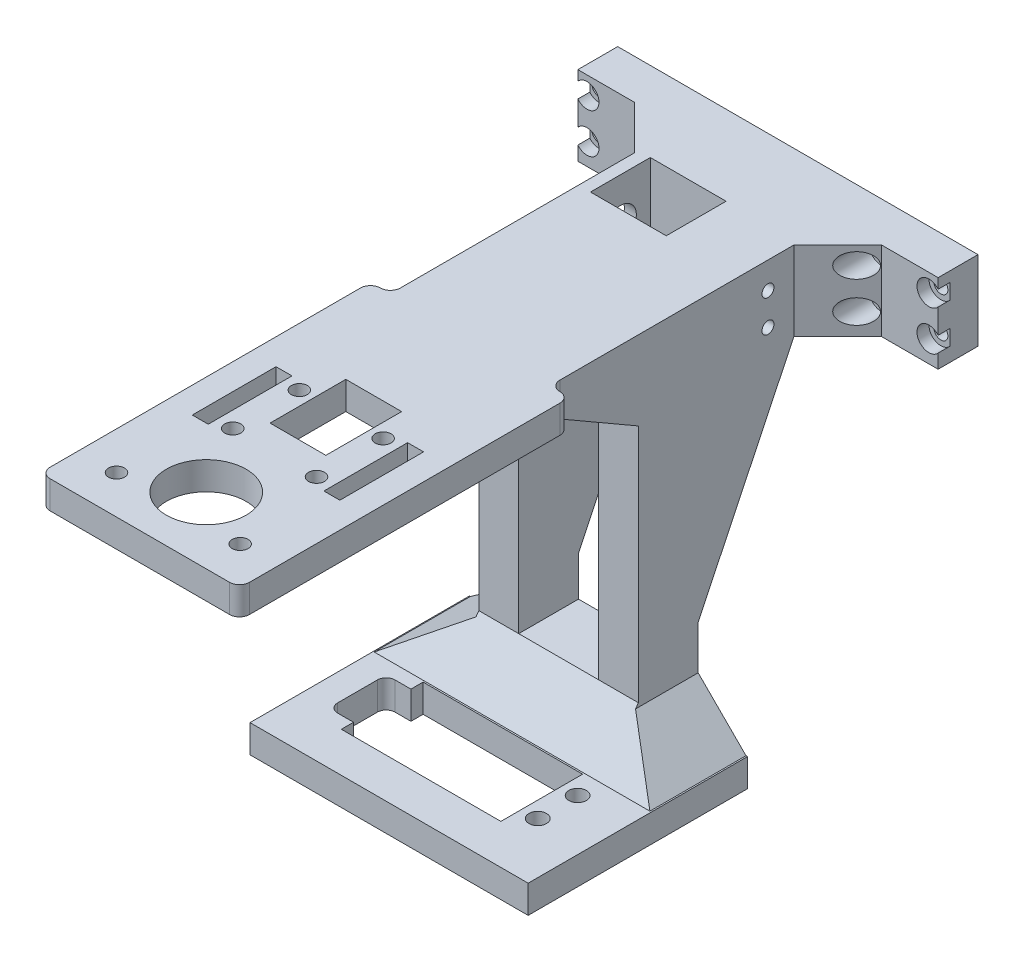
from build123d import *

# Parameters (mm, degrees)
SKETCH_1_W           = 90.34
SKETCH_1_H           = 19.9
SKETCH_1_R           = 1.75
EXTRUDE_1_DEPTH      = 10
SKETCH_2_W           = 40
SKETCH_2_H           = 19.9
EXTRUDE_2_DEPTH      = 50
SKETCH_3_W           = 40
SKETCH_3_H           = 15
EXTRUDE_3_DEPTH      = 73
SKETCH_4_R           = 2.2
EXTRUDE_4_DEPTH      = 7
SKETCH_15_R          = 3
CUT_EXTRUDE_5_DEPTH  = 3
CUT_EXTRUDE_START    = -10
SKETCH_16_W          = 15
SKETCH_16_H          = 60
CUT_EXTRUDE_6_DEPTH  = 20
CHAMFER_3_SIZE       = 9.102697997
CHAMFER_3_SIZE_2     = 13
CHAMFER_1_SIZE       = 11
SKETCH_22_W          = 40
SKETCH_22_H          = 7
EXTRUDE_7_DEPTH      = 105
SKETCH_23_R          = 2
SKETCH_23_R_2        = 10
SKETCH_23_W          = 4
SKETCH_23_H          = 21
SKETCH_23_W_2        = 14
SKETCH_23_H_2        = 19
CUT_EXTRUDE_9_DEPTH  = 7
CHAMFER_4_SIZE       = 12.8
CHAMFER_4_SIZE2      = 22.170250337
SKETCH_25_W          = 82.829749663
SKETCH_25_H          = 7
EXTRUDE_8_DEPTH      = 5
SKETCH_26_W          = 82.829749663
SKETCH_26_H          = 7
EXTRUDE_9_DEPTH      = 5
SKETCH_28_W          = 64.74
SKETCH_28_H          = 5
EXTRUDE_10_DEPTH     = 7
SKETCH_31_W          = 25
SKETCH_31_H          = 19.9
SKETCH_31_W_2        = 10
EXTRUDE_12_DEPTH     = 20
SKETCH_33_R          = 4
CUT_EXTRUDE_11_DEPTH = 10
SKETCH_32_R          = 1.5
CUT_EXTRUDE_12_DEPTH = 30
EXTRUDE_13_DEPTH     = 10
EXTRUDE_14_DEPTH     = 10
FILLET_2_R           = 2.5
FILLET_3_R           = 2.5
EXTRUDE_START        = 20
EXTRUDE_15_DEPTH     = 10
SKETCH_38_W          = 55
SKETCH_38_H          = 7
EXTRUDE_16_DEPTH     = 5
CHAMFER_5_SIZE       = 12
CHAMFER_5_SIZE2      = 17.137776081
CHAMFER_6_SIZE       = 12
EXTRUDE_START_2      = 3
SKETCH_39_W          = 15
SKETCH_39_H          = 19.9
SKETCH_39_R          = 1.5
EXTRUDE_17_DEPTH     = 3
SKETCH_40_W          = 15
SKETCH_40_H          = 19.9
SKETCH_40_R          = 4
EXTRUDE_18_DEPTH     = 3
SKETCH_41_W          = 10
SKETCH_41_H          = 15
CUT_EXTRUDE_13_DEPTH = 60
SKETCH_42_W          = 15
SKETCH_42_H          = 19.9
SKETCH_42_R          = 3.5
EXTRUDE_20_DEPTH     = 5


# Some blends are built 0.0001 mm under size
with BuildPart() as part:
    # 草图1 → 凸台-拉伸1 (new body)
    with BuildSketch(Plane.XY):
        Rectangle(SKETCH_1_W, SKETCH_1_H)
        with Locations((-42.87, 5.5)):
            Circle(SKETCH_1_R, mode=Mode.SUBTRACT)
        with Locations((-42.87, -4.5)):
            Circle(SKETCH_1_R, mode=Mode.SUBTRACT)
        with Locations((-27.87, 5.5)):
            Circle(SKETCH_1_R, mode=Mode.SUBTRACT)
        with Locations((-27.87, -4.5)):
            Circle(SKETCH_1_R, mode=Mode.SUBTRACT)
        with Locations(Location((27.87, -4.5, 0), (0, 0, 180))):
            Circle(SKETCH_1_R, mode=Mode.SUBTRACT)
        with Locations(Location((27.87, 5.5, 0), (0, 0, 180))):
            Circle(SKETCH_1_R, mode=Mode.SUBTRACT)
        with Locations(Location((42.87, -4.5, 0), (0, 0, 180))):
            Circle(SKETCH_1_R, mode=Mode.SUBTRACT)
        with Locations(Location((42.87, 5.5, 0), (0, 0, 180))):
            Circle(SKETCH_1_R, mode=Mode.SUBTRACT)
    extrude(amount=EXTRUDE_1_DEPTH)

    # 草图2 → 凸台-拉伸2 (add)
    with BuildSketch(Plane.XY.offset(10)):
        Rectangle(SKETCH_2_W, SKETCH_2_H)
    extrude(amount=EXTRUDE_2_DEPTH)

    # 草图3 → 凸台-拉伸3 (add)
    with BuildSketch(Plane.XZ.offset(9.95)):
        with Locations((0, 52.5)):
            Rectangle(SKETCH_3_W, SKETCH_3_H)
    extrude(amount=EXTRUDE_3_DEPTH)

    # 草图4 → 凸台-拉伸4 (add)
    with BuildSketch(Plane.XZ.offset(82.95)):
        Polygon((-32.37, 95), (32.37, 95), (32.37, 60), (32.37, 45), (-32.37, 45), (-32.37, 60), align=None)
        with Locations(Location((19.53, 84.75, 0), (0, 0, 270))):
            Circle(SKETCH_4_R, mode=Mode.SUBTRACT)
        with Locations(Location((19.53, 74.75, 0), (0, 0, 90))):
            Circle(SKETCH_4_R, mode=Mode.SUBTRACT)
        with BuildLine():
            Line((-24.47, 90), (15.53, 90))
            Line((15.53, 90), (15.53, 69.5))
            Line((15.53, 69.5), (-24.47, 69.5))
            Line((-24.47, 69.5), (-24.47, 72.55))
            Line((-24.47, 72.55), (-28.469997184, 72.55))
            ThreePointArc((-28.469997184, 72.55), (-30.025633923, 73.194364086), (-30.67, 74.75))
            Line((-30.67, 74.75), (-30.67, 84.75))
            ThreePointArc((-30.67, 84.75), (-30.025633923, 86.305635914), (-28.469997184, 86.95))
            Line((-28.469997184, 86.95), (-24.47, 86.95))
            Line((-24.47, 86.95), (-24.47, 90))
        make_face(mode=Mode.SUBTRACT)
    extrude(amount=EXTRUDE_4_DEPTH)

    # 草图15 → 切除-拉伸5 (cut)
    with BuildSketch(Plane.XY.offset(10)):
        with Locations((-42.87, 5.5)):
            Circle(SKETCH_15_R)
        with Locations((-42.87, -4.5)):
            Circle(SKETCH_15_R)
        with Locations((-27.87, 5.5)):
            Circle(SKETCH_15_R)
        with Locations((-27.87, -4.5)):
            Circle(SKETCH_15_R)
        with Locations((27.87, 5.5)):
            Circle(SKETCH_15_R)
        with Locations((27.87, -4.5)):
            Circle(SKETCH_15_R)
        with Locations((42.87, 5.5)):
            Circle(SKETCH_15_R)
        with Locations((42.87, -4.5)):
            Circle(SKETCH_15_R)
    extrude(amount=-CUT_EXTRUDE_5_DEPTH, mode=Mode.SUBTRACT)

    # 草图16 → 切除-拉伸6 (cut)
    with BuildSketch(Plane.ZY.offset(20).offset(CUT_EXTRUDE_START)):
        Polygon((10, -9.95), (45, -9.95), (60, -9.95), (60, 9.95), (10, 9.95), align=None)
        with Locations((52.5, -39.95)):
            Rectangle(SKETCH_16_W, SKETCH_16_H)
    extrude(amount=-CUT_EXTRUDE_6_DEPTH, mode=Mode.SUBTRACT)

    # 倒角3
    # the kernel refuses this chamfer: 13, 9.102697997 mm, written as the material it adds along each edge
    with BuildSketch(Plane(origin=(-20, -82.95, 60), x_dir=(0, -0.045263737714020945, 0.9989750717851553), z_dir=(1, 0, 0))) as chamfer_3_piece_1:
        Polygon((CHAMFER_3_SIZE * 0.998975071755, -CHAMFER_3_SIZE * 0.0452637377127), (-CHAMFER_3_SIZE_2 * 0.045263737714, -CHAMFER_3_SIZE_2 * 0.998975071785), (0, 0), align=None)
    extrude(amount=40)

    # 倒角1
    # the kernel refuses this chamfer: 11 mm, written as the material it adds along each edge
    with BuildSketch(Plane(origin=(20, 9.95, 10), x_dir=(-0.027495876610586587, 0, 0.9996219169112966), z_dir=(0, -1, 0))) as chamfer_1_piece_1_section:
        Polygon((CHAMFER_1_SIZE * 0.999621916911, -CHAMFER_1_SIZE * 0.0274958766106), (-CHAMFER_1_SIZE * 0.0274958766106, -CHAMFER_1_SIZE * 0.999621916911), (0, 0), align=None)
    chamfer_1_piece_1 = extrude(amount=19.9, mode=Mode.PRIVATE)
    chamfer_1_piece_1 = chamfer_1_piece_1 - Plane(origin=(27.87, 5.5, 13.954433194), x_dir=(1, 0, 0), z_dir=(0, 0, 1)) * Cylinder(3, 84, mode=Mode.PRIVATE)
    chamfer_1_piece_1 = chamfer_1_piece_1 - Plane(origin=(27.87, -4.5, 13.954433194), x_dir=(1, 0, 0), z_dir=(0, 0, 1)) * Cylinder(3, 84, mode=Mode.PRIVATE)
    add(chamfer_1_piece_1)
    with BuildSketch(Plane(origin=(-20, -9.95, 10), x_dir=(-0.9996219169112968, 0, -0.027495876610586417), z_dir=(0, 1, 0))) as chamfer_1_piece_2_section:
        Polygon((CHAMFER_1_SIZE * 0.999621916911, CHAMFER_1_SIZE * 0.0274958766106), (-CHAMFER_1_SIZE * 0.0274958766106, CHAMFER_1_SIZE * 0.999621916911), (0, 0), align=None)
    chamfer_1_piece_2 = extrude(amount=19.9, mode=Mode.PRIVATE)
    chamfer_1_piece_2 = chamfer_1_piece_2 - Plane(origin=(-27.87, -4.5, 13.954436556), x_dir=(1, 0, 0), z_dir=(0, 0, 1)) * Cylinder(3, 84, mode=Mode.PRIVATE)
    chamfer_1_piece_2 = chamfer_1_piece_2 - Plane(origin=(-27.87, 5.5, 13.954436556), x_dir=(1, 0, 0), z_dir=(0, 0, 1)) * Cylinder(3, 84, mode=Mode.PRIVATE)
    add(chamfer_1_piece_2)

    # 草图22 → 凸台-拉伸7 (add)
    with BuildSketch(Plane.XY.offset(60)):
        with Locations((0, 6.45)):
            Rectangle(SKETCH_22_W, SKETCH_22_H)
    extrude(amount=EXTRUDE_7_DEPTH)

    # 草图23 → 切除-拉伸9 (cut)
    with BuildSketch(Plane(origin=(0, 9.95, 0), x_dir=(1, 0, 0), z_dir=(0, 1, 0))):
        with Locations(Location((15.5, -155.35, 0), (0, 0, 270))):
            Circle(SKETCH_23_R)
        with Locations(Location((-15.5, -155.35, 0), (0, 0, 270))):
            Circle(SKETCH_23_R)
        with Locations(Location((10.5, -114.5, 0), (0, 0, 270))):
            Circle(SKETCH_23_R)
        with Locations(Location((-10.5, -114.5, 0), (0, 0, 90))):
            Circle(SKETCH_23_R)
        with Locations(Location((-10.5, -131.2, 0), (0, 0, 270))):
            Circle(SKETCH_23_R)
        with Locations(Location((10.5, -131.2, 0), (0, 0, 90))):
            Circle(SKETCH_23_R)
        with Locations(Location((0, -148.35, 0), (0, 0, 270))):
            Circle(SKETCH_23_R_2)
        with Locations((16.5, -122.85)):
            Rectangle(SKETCH_23_W, SKETCH_23_H)
        with Locations((-16.5, -122.85)):
            Rectangle(SKETCH_23_W, SKETCH_23_H)
        with Locations((0, -115.85)):
            Rectangle(SKETCH_23_W_2, SKETCH_23_H_2)
    extrude(amount=-CUT_EXTRUDE_9_DEPTH, mode=Mode.SUBTRACT)

    # 倒角4
    chamfer_4_edges = [part.edges().sort_by_distance(p)[0] for p in [
        (-15, 2.95, 60),
    ]]
    chamfer_4_side = [part.faces().sort_by_distance(p)[0] for p in [
        (-15, -33.5, 60),
    ]]
    chamfer(chamfer_4_edges, length=CHAMFER_4_SIZE, length2=CHAMFER_4_SIZE2, reference=chamfer_4_side[0])

    # 草图25 → 凸台-拉伸8 (add)
    with BuildSketch(Plane(origin=(20, 0, 0), x_dir=(0, 0, -1), z_dir=(1, 0, 0))):
        with Locations((-123.585125168, 6.45)):
            Rectangle(SKETCH_25_W, SKETCH_25_H)
    extrude(amount=EXTRUDE_8_DEPTH)

    # 草图26 → 凸台-拉伸9 (add)
    with BuildSketch(Plane.ZY.offset(20)):
        with Locations((123.585125168, 6.45)):
            Rectangle(SKETCH_26_W, SKETCH_26_H)
    extrude(amount=EXTRUDE_9_DEPTH)

    # 草图28 → 凸台-拉伸10 (add)
    with BuildSketch(Plane.XZ.offset(89.95)):
        with Locations((0, 97.5)):
            Rectangle(SKETCH_28_W, SKETCH_28_H)
    extrude(amount=-EXTRUDE_10_DEPTH)

    # 草图31 → 凸台-拉伸12 (add)
    with BuildSketch(Plane(origin=(-10, 0, 0), x_dir=(0, 0, -1), z_dir=(1, 0, 0))):
        with Locations((-47.5, 0)):
            Rectangle(SKETCH_31_W, SKETCH_31_H)
        with Locations((-15, 0)):
            Rectangle(SKETCH_31_W_2, SKETCH_31_H)
    extrude(amount=EXTRUDE_12_DEPTH)

    # 草图33 → 切除-拉伸11 (cut)
    with BuildSketch(Plane.ZY.offset(20)):
        with Locations((27.5, -0.719309013)):
            Circle(SKETCH_33_R)
    extrude(amount=-CUT_EXTRUDE_11_DEPTH, mode=Mode.SUBTRACT)

    # 草图32 → 切除-拉伸12 (cut)
    with BuildSketch(Plane(origin=(-10, 0, 0), x_dir=(0, 0, -1), z_dir=(1, 0, 0))):
        with Locations(Location((-27.5, 3.280690987, 0), (0, 0, 180))):
            Circle(SKETCH_32_R)
        with Locations(Location((-27.5, -4.719309013, 0), (0, 0, 180))):
            Circle(SKETCH_32_R)
    extrude(amount=CUT_EXTRUDE_12_DEPTH, mode=Mode.SUBTRACT)

    # 草图35 → 凸台-拉伸13 (add)
    with BuildSketch(Plane.ZY.offset(20)):
        Polygon((21, -9.95), (45, -59.95), (45, -9.95), align=None)
    extrude(amount=-EXTRUDE_13_DEPTH)

    # 草图36 → 凸台-拉伸14 (add)
    with BuildSketch(Plane(origin=(20, 0, 0), x_dir=(0, 0, -1), z_dir=(1, 0, 0))):
        Polygon((-45, -59.95), (-21, -9.95), (-35, -9.95), (-45, -9.95), align=None)
    extrude(amount=-EXTRUDE_14_DEPTH)

    # 圆角2
    fillet_2_edges = [part.edges().sort_by_distance(p)[0] for p in [
        (-25, 6.45, 82.170250337),
        (25, 6.45, 82.170250337),
        (20, 6.45, 82.170250337),
        (-20, 6.45, 82.170250337),
    ]]
    fillet(fillet_2_edges, radius=FILLET_2_R - 0.0001)  # a hair under: the kernel refuses the full size

    # 圆角3
    fillet_3_edges = [part.edges().sort_by_distance(p)[0] for p in [
        (25, 6.45, 165),
        (-25, 6.45, 165),
    ]]
    fillet(fillet_3_edges, radius=FILLET_3_R)

    # 草图37 → 凸台-拉伸15 (add)
    with BuildSketch(Plane(origin=(-10, 0, 0), x_dir=(0, 0, -1), z_dir=(1, 0, 0)).offset(EXTRUDE_START)):
        Polygon((-60, -9.85), (-60, 2.95), (-82.170250337, 2.95), align=None)
    extrude(amount=EXTRUDE_15_DEPTH)

    # 草图38 → 凸台-拉伸16 (add)
    with BuildSketch(Plane.ZY.offset(32.37)):
        with Locations((72.5, -86.45)):
            Rectangle(SKETCH_38_W, SKETCH_38_H)
    extrude(amount=EXTRUDE_16_DEPTH)

    # 倒角5
    chamfer_5_edges = [part.edges().sort_by_distance(p)[0] for p in [
        (-20, -82.95, 57.051348998),
    ]]
    chamfer_5_side = [part.faces().sort_by_distance(p)[0] for p in [
        (-20, -25.655166951, 48.045646106),
    ]]
    chamfer(chamfer_5_edges, length=CHAMFER_5_SIZE, length2=CHAMFER_5_SIZE2, reference=chamfer_5_side[0])

    # 倒角6
    chamfer_6_edges = [part.edges().sort_by_distance(p)[0] for p in [
        (20, -82.95, 57.051348998),
    ]]
    chamfer(chamfer_6_edges, length=CHAMFER_6_SIZE)

    # 草图39 → 凸台-拉伸17 (add)
    with BuildSketch(Plane.ZY.offset(-10).offset(EXTRUDE_START_2)):
        with Locations((27.5, 0)):
            Rectangle(SKETCH_39_W, SKETCH_39_H)
        with Locations((27.5, 3.280690987)):
            Circle(SKETCH_39_R, mode=Mode.SUBTRACT)
        with Locations((27.5, -4.719309013)):
            Circle(SKETCH_39_R, mode=Mode.SUBTRACT)
    extrude(amount=-EXTRUDE_17_DEPTH)

    # 草图40 → 凸台-拉伸18 (add)
    with BuildSketch(Plane(origin=(-10, 0, 0), x_dir=(0, 0, -1), z_dir=(1, 0, 0))):
        with Locations((-27.5, 0)):
            Rectangle(SKETCH_40_W, SKETCH_40_H)
        with Locations(Location((-27.5, -0.719309013, 0), (0, 0, 180))):
            Circle(SKETCH_40_R, mode=Mode.SUBTRACT)
    extrude(amount=EXTRUDE_18_DEPTH)

    # 草图41 → 切除-拉伸13 (cut)
    with BuildSketch(Plane(origin=(0, 9.95, 0), x_dir=(1, 0, 0), z_dir=(0, 1, 0))):
        with Locations((-12, -27.5)):
            Rectangle(SKETCH_41_W, SKETCH_41_H)
    extrude(amount=-CUT_EXTRUDE_13_DEPTH, mode=Mode.SUBTRACT)

    # 草图42 → 凸台-拉伸20 (add)
    with BuildSketch(Plane.ZY.offset(-7)):
        with Locations((27.5, 0)):
            Rectangle(SKETCH_42_W, SKETCH_42_H)
        with Locations((27.5, 3.280690987)):
            Circle(SKETCH_42_R, mode=Mode.SUBTRACT)
        with Locations((27.5, -4.719309013)):
            Circle(SKETCH_42_R, mode=Mode.SUBTRACT)
    extrude(amount=EXTRUDE_20_DEPTH)


solid = part.part
